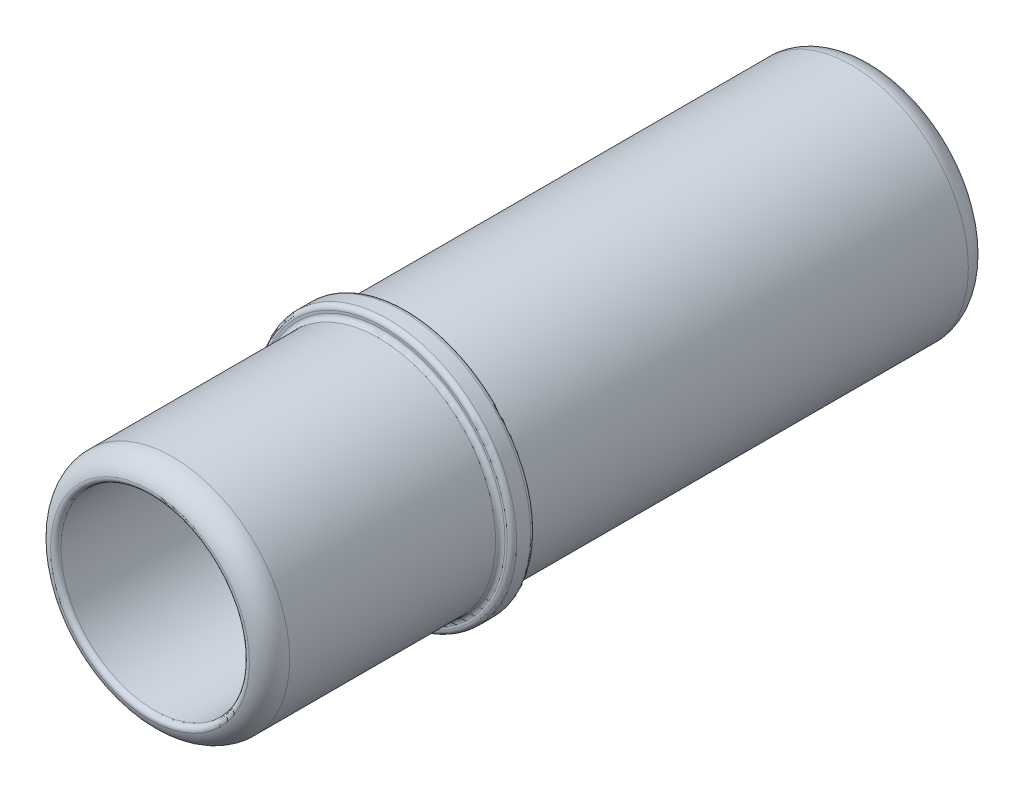
from build123d import *

# Parameters (mm, degrees)
SKETCH1_R           = 0.55
BOSS_EXTRUDE1_DEPTH = 0.1
SKETCH2_R           = 0.5
BOSS_EXTRUDE2_DEPTH = 1
BOSS_EXTRUDE3_START = 2
SKETCH3_R           = 0.5
BOSS_EXTRUDE3_DEPTH = 2
SKETCH4_R           = 0.4
CUT_EXTRUDE1_DEPTH  = 3.1
FILLET1_R           = 0.1
FILLET2_R           = 0.1
FILLET3_R           = 0.02
FILLET4_R           = 0.02
FILLET5_R           = 0.02
FILLET6_R           = 0.02
FILLET7_R           = 0.02
FILLET8_R           = 0.02


with BuildPart() as part:
    # Sketch1 → Boss-Extrude1 (new body)
    with BuildSketch(Plane.XY):
        Circle(SKETCH1_R)
    extrude(amount=BOSS_EXTRUDE1_DEPTH)

    # Sketch2 → Boss-Extrude2 (add)
    with BuildSketch(Plane.XY.offset(0.1)):
        Circle(SKETCH2_R)
    extrude(amount=BOSS_EXTRUDE2_DEPTH)

    # Sketch3 → Boss-Extrude3 (add)
    with BuildSketch(Plane(origin=(0, 0, 0), x_dir=(-1, 0, 0), z_dir=(0, 0, -1)).offset(BOSS_EXTRUDE3_START)):
        with Locations(Location((0, 0, 0), (0, 0, 180))):
            Circle(SKETCH3_R)
    extrude(amount=-BOSS_EXTRUDE3_DEPTH)

    # Sketch4 → Cut-Extrude1 (cut)
    with BuildSketch(Plane(origin=(0, 0, -2), x_dir=(-1, 0, 0), z_dir=(0, 0, -1))):
        Circle(SKETCH4_R)
    extrude(amount=-CUT_EXTRUDE1_DEPTH, mode=Mode.SUBTRACT)

    # Fillet1
    fillet1_edges = [part.edges().sort_by_distance(p)[0] for p in [
        (-0.5, 0, -2),
    ]]
    fillet(fillet1_edges, radius=FILLET1_R - 0.0001)  # a hair under: the kernel refuses the full size

    # Fillet2
    fillet2_edges = [part.edges().sort_by_distance(p)[0] for p in [
        (-0.5, 0, 1.1),
    ]]
    fillet(fillet2_edges, radius=FILLET2_R - 0.0001)  # a hair under: the kernel refuses the full size

    # Fillet3
    fillet3_edges = [part.edges().sort_by_distance(p)[0] for p in [
        (-0.55, 0, 0.1),
    ]]
    fillet(fillet3_edges, radius=FILLET3_R)

    # Fillet4
    fillet4_edges = [part.edges().sort_by_distance(p)[0] for p in [
        (-0.55, 0, 0),
    ]]
    fillet(fillet4_edges, radius=FILLET4_R)

    # Fillet5
    fillet5_edges = [part.edges().sort_by_distance(p)[0] for p in [
        (-0.5, 0, 0),
    ]]
    fillet(fillet5_edges, radius=FILLET5_R)

    # Fillet6
    fillet6_edges = [part.edges().sort_by_distance(p)[0] for p in [
        (-0.5, 0, 0.1),
    ]]
    fillet(fillet6_edges, radius=FILLET6_R)

    # Fillet7
    fillet7_edges = [part.edges().sort_by_distance(p)[0] for p in [
        (0.4, 0, -2),
    ]]
    fillet(fillet7_edges, radius=FILLET7_R)

    # Fillet8
    fillet8_edges = [part.edges().sort_by_distance(p)[0] for p in [
        (0.4, 0, 1.1),
    ]]
    fillet(fillet8_edges, radius=FILLET8_R)


solid = part.part
